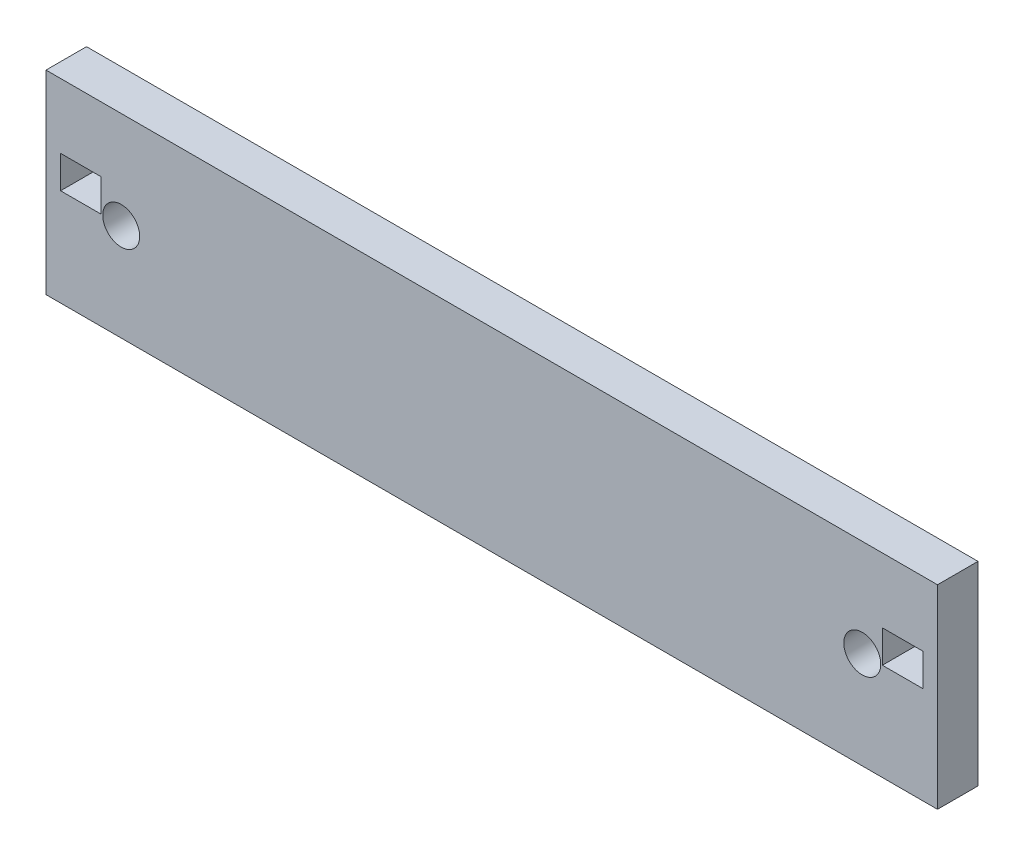
from build123d import *

# Parameters (mm, degrees)
SKETCH1_W           = 34.925
SKETCH1_H           = 7.62
SKETCH1_R           = 0.7239
SKETCH1_W_2         = 1.5875
SKETCH1_H_2         = 1.27
BOSS_EXTRUDE1_DEPTH = 1.5875


with BuildPart() as part:
    # Sketch1 → Boss-Extrude1 (new body)
    with BuildSketch(Plane.XY):
        with Locations((-1.5875, 0)):
            Rectangle(SKETCH1_W, SKETCH1_H)
        with Locations((-16.1036, 0)):
            Circle(SKETCH1_R, mode=Mode.SUBTRACT)
        with Locations((12.9286, 0)):
            Circle(SKETCH1_R, mode=Mode.SUBTRACT)
        with Locations((-17.68475, 0.635)):
            Rectangle(SKETCH1_W_2, SKETCH1_H_2, mode=Mode.SUBTRACT)
        with Locations((14.50975, 0.635)):
            Rectangle(SKETCH1_W_2, SKETCH1_H_2, mode=Mode.SUBTRACT)
    extrude(amount=BOSS_EXTRUDE1_DEPTH)


solid = part.part
